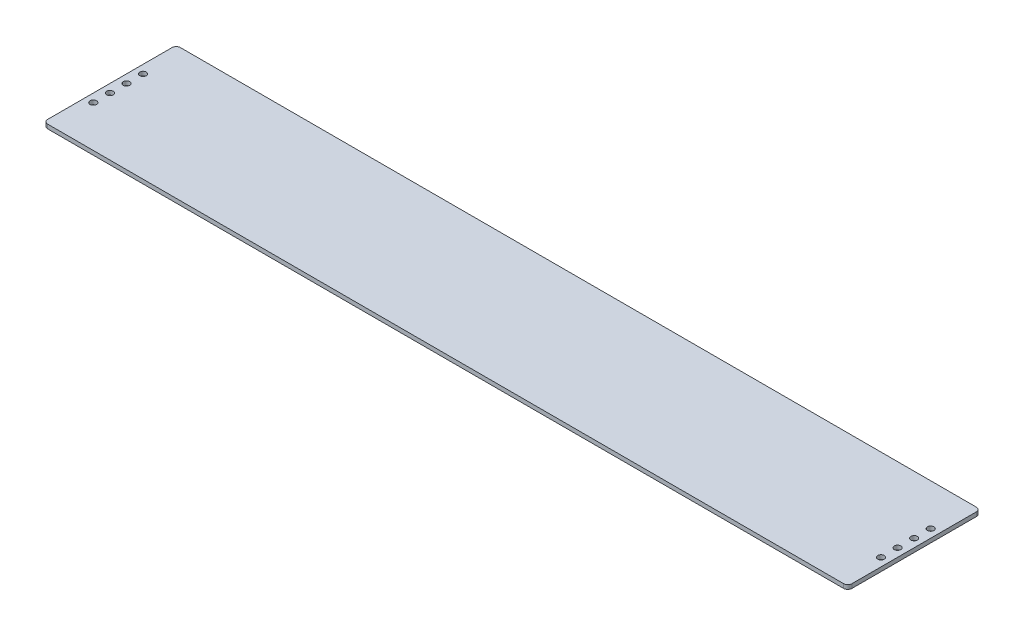
from build123d import *

# Parameters (mm, degrees)
SKETCH1_W           = 615.95
SKETCH1_H           = 101.6
SKETCH1_R           = 2.4892
BOSS_EXTRUDE1_DEPTH = 3.175
FILLET1_R           = 3.175


with BuildPart() as part:
    # Sketch1 → Boss-Extrude1 (new body)
    with BuildSketch(Plane(origin=(0, 0, 0), x_dir=(1, 0, 0), z_dir=(0, 1, 0))):
        Rectangle(SKETCH1_W, SKETCH1_H)
        with Locations((-301.625, 19.05)):
            Circle(SKETCH1_R, mode=Mode.SUBTRACT)
        with Locations((-301.625, 6.35)):
            Circle(SKETCH1_R, mode=Mode.SUBTRACT)
        with Locations((-301.625, -6.35)):
            Circle(SKETCH1_R, mode=Mode.SUBTRACT)
        with Locations((-301.625, -19.05)):
            Circle(SKETCH1_R, mode=Mode.SUBTRACT)
        with Locations((301.625, -19.05)):
            Circle(SKETCH1_R, mode=Mode.SUBTRACT)
        with Locations((301.625, -6.35)):
            Circle(SKETCH1_R, mode=Mode.SUBTRACT)
        with Locations((301.625, 6.35)):
            Circle(SKETCH1_R, mode=Mode.SUBTRACT)
        with Locations((301.625, 19.05)):
            Circle(SKETCH1_R, mode=Mode.SUBTRACT)
    extrude(amount=BOSS_EXTRUDE1_DEPTH)

    # Fillet1
    fillet1_edges = [part.edges().sort_by_distance(p)[0] for p in [
        (307.975, 1.5875, 50.8),
        (-307.975, 1.5875, -50.8),
        (307.975, 1.5875, -50.8),
        (-307.975, 1.5875, 50.8),
    ]]
    fillet(fillet1_edges, radius=FILLET1_R)


solid = part.part
